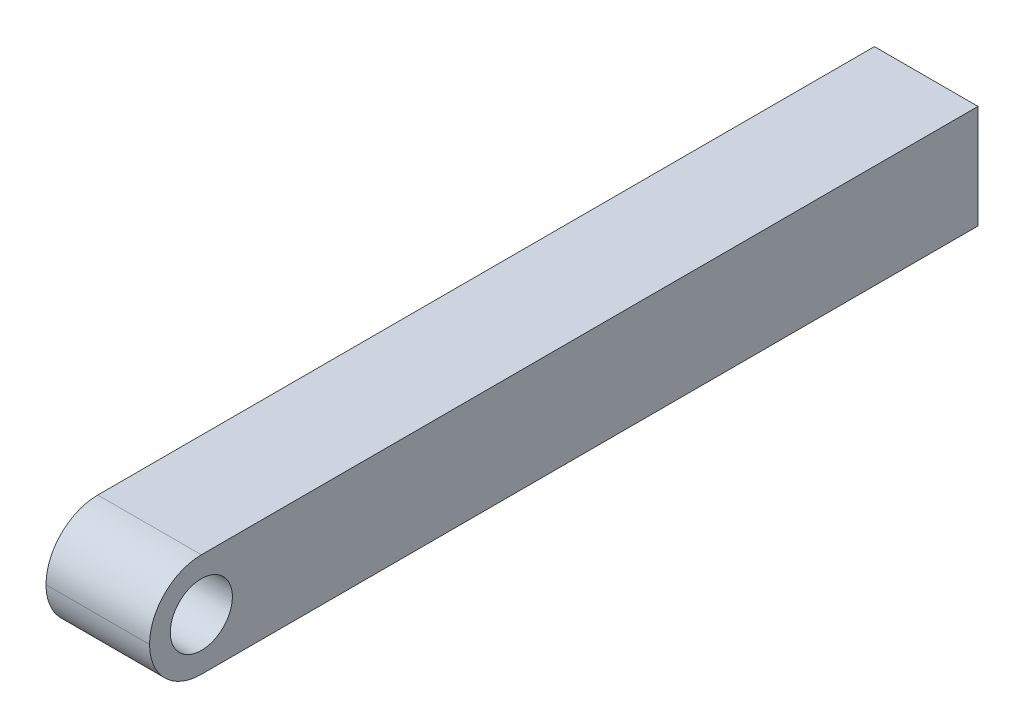
from build123d import *

# Parameters (mm, degrees)
SKETCH1_W           = 2.54
SKETCH1_H           = 2.54
BOSS_EXTRUDE1_DEPTH = 20.32
FILLET1_R           = 1.27
SKETCH2_R           = 0.762
CUT_EXTRUDE1_DEPTH  = 21.635057548


with BuildPart() as part:
    # Sketch1 → Boss-Extrude1 (new body)
    with BuildSketch(Plane.XY):
        with Locations((-1.27, 1.27)):
            Rectangle(SKETCH1_W, SKETCH1_H)
    extrude(amount=BOSS_EXTRUDE1_DEPTH)

    # Fillet1
    fillet1_edges = [part.edges().sort_by_distance(p)[0] for p in [
        (-1.27, 0, 20.32),
        (-1.27, 2.54, 20.32),
    ]]
    fillet(fillet1_edges, radius=FILLET1_R - 0.0001)  # a hair under: the kernel refuses the full size

    # Sketch2 → Cut-Extrude1 (cut, through all)
    with BuildSketch(Plane(origin=(0, 0, 0), x_dir=(0, 0, -1), z_dir=(1, 0, 0))):
        with Locations(Location((-19.05, 1.27, 0), (0, 0, 90))):
            Circle(SKETCH2_R)
    extrude(amount=-CUT_EXTRUDE1_DEPTH, mode=Mode.SUBTRACT)


solid = part.part
